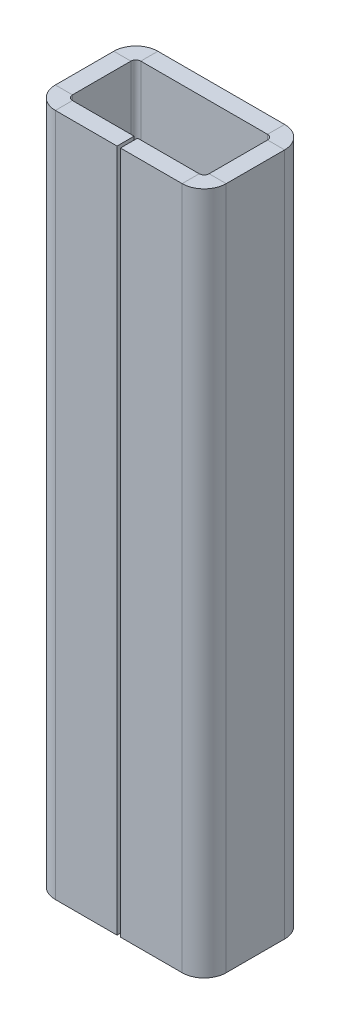
from build123d import *

# Parameters (mm, degrees)
BASE_FLANGE2_DEPTH = 101.6
CUT_EXTRUDE1_DEPTH = 1.27


# Sheet-metal steps are written as plain solids
with BuildPart() as part:
    # Sketch1 → Base-Flange2 (new body)
    with BuildSketch(Plane(origin=(0, 0, 0), x_dir=(1, 0, 0), z_dir=(0, 1, 0))):
        with BuildLine():
            Line((12.954, 0), (22.1234, 0))
            ThreePointArc((22.1234, 0), (24.440306079, 0.959693921), (25.4, 3.2766))
            Line((25.4, 3.2766), (25.4, 11.9634))
            ThreePointArc((25.4, 11.9634), (24.440306079, 14.280306079), (22.1234, 15.24))
            Line((22.1234, 15.24), (3.2766, 15.24))
            ThreePointArc((3.2766, 15.24), (0.959693921, 14.280306079), (0, 11.9634))
            Line((0, 11.9634), (0, 3.2766))
            ThreePointArc((0, 3.2766), (0.959693921, 0.959693921), (3.2766, 0))
            Line((3.2766, 0), (12.446, 0))
            Line((12.446, 0), (12.446, 2.54))
            Line((12.446, 2.54), (3.2766, 2.54))
            ThreePointArc((3.2766, 2.54), (2.755745145, 2.755745145), (2.54, 3.2766))
            Line((2.54, 3.2766), (2.54, 11.9634))
            ThreePointArc((2.54, 11.9634), (2.755745145, 12.484254855), (3.2766, 12.7))
            Line((3.2766, 12.7), (22.1234, 12.7))
            ThreePointArc((22.1234, 12.7), (22.644254855, 12.484254855), (22.86, 11.9634))
            Line((22.86, 11.9634), (22.86, 3.2766))
            ThreePointArc((22.86, 3.2766), (22.644254855, 2.755745145), (22.1234, 2.54))
            Line((22.1234, 2.54), (12.954, 2.54))
            Line((12.954, 2.54), (12.954, 0))
        make_face()
    extrude(amount=BASE_FLANGE2_DEPTH)

    # Sketch2 → Cut-Extrude1 (cut)
    with BuildSketch(Plane(origin=(0, 0, -15.24), x_dir=(-1, 0, 0), z_dir=(0, 0, -1))):
        Polygon((-17.544402312, 4.806950327), (-17.259466414, 4.806950327), (-17.259466414, 3.597880815), (-15.93591373, 4.806950327), (-15.529498466, 4.806950327), (-17.089649708, 3.38227084), (-15.407383081, 1.631950327), (-15.787085605, 1.631950327), (-17.259466414, 3.164116793), (-17.259466414, 1.631950327), (-17.544402312, 1.631950327), align=None)
        Polygon((-14.939274107, 4.806950327), (-14.654338209, 4.806950327), (-14.654338209, 1.957591352), (-13.433184363, 1.957591352), (-13.433184363, 1.631950327), (-14.939274107, 1.631950327), align=None)
        Polygon((-13.107543337, 4.806950327), (-12.813067176, 4.806950327), (-12.191677953, 2.47848979), (-11.267544339, 4.806950327), (-11.226203193, 4.806950327), (-10.319242055, 2.494390231), (-9.694672744, 4.806950327), (-9.403376671, 4.806950327), (-10.259456398, 1.631950327), (-10.300161526, 1.631950327), (-11.255460004, 4.060265631), (-12.222206799, 1.631950327), (-12.262911927, 1.631950327), align=None)
        Polygon((-8.996325389, 4.481309301), (-8.996325389, 4.806950327), (-7.327415132, 4.806950327), (-8.659236046, 1.957591352), (-7.36812026, 1.957591352), (-7.36812026, 1.631950327), (-9.118440773, 1.631950327), (-7.78661986, 4.481309301), align=None)
    extrude(amount=-CUT_EXTRUDE1_DEPTH, mode=Mode.SUBTRACT)


solid = part.part
